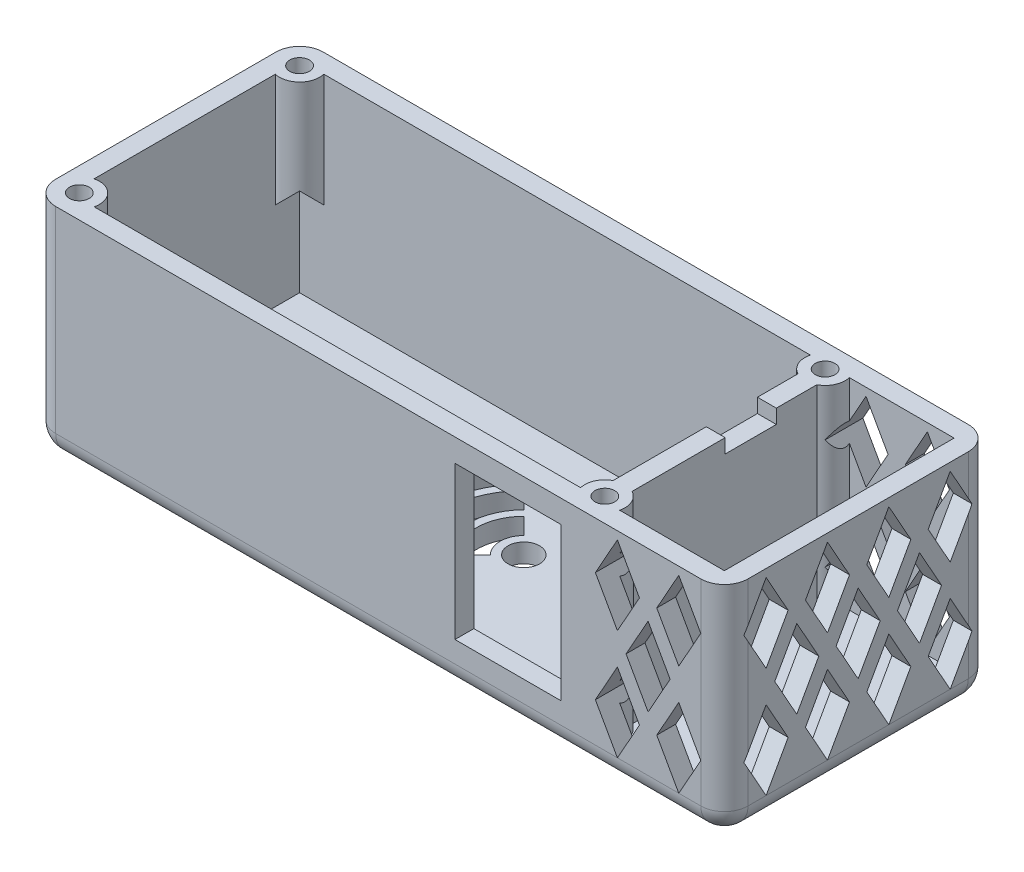
from build123d import *

# Parameters (mm, degrees)
SKETCH1_W           = 71
SKETCH1_H           = 34
BOSS_EXTRUDE1_DEPTH = 28
SHELL1_T            = -2.4
SKETCH2_W           = 2.4
SKETCH2_H           = 6.5
CUT_EXTRUDE1_DEPTH  = 1.8
SKETCH3_W           = 17
SKETCH3_H           = 34
BOSS_EXTRUDE2_DEPTH = 28
SKETCH4_W           = 14.6
SKETCH4_H           = 29.2
CUT_EXTRUDE2_DEPTH  = 25.6
CUT_EXTRUDE3_REACH  = 63.881
SKETCH5_R           = 2
CUT_EXTRUDE4_REACH  = 95.899
CUT_EXTRUDE5_REACH  = 69.371
SKETCH8_W           = 13.5
SKETCH8_H           = 19.4
FILLET1_R           = 3
FILLET2_R           = 3
SKETCH11_R          = 2.5546875
BOSS_EXTRUDE3_DEPTH = 25.6
SKETCH14_R          = 2.5546875
BOSS_EXTRUDE4_DEPTH = 12
CHAMFER1_SIZE       = 2.4
CUT_EXTRUDE6_DEPTH  = 69.529190861
SKETCH12_R          = 1.25
CUT_EXTRUDE7_DEPTH  = 12


# Some blends are built 0.0001 mm under size
with BuildPart() as part:
    # Sketch1 → Boss-Extrude1 (new body)
    with BuildSketch(Plane(origin=(0, 0, 0), x_dir=(1, 0, 0), z_dir=(0, 1, 0))):
        Rectangle(SKETCH1_W, SKETCH1_H)
    extrude(amount=BOSS_EXTRUDE1_DEPTH)

    # Shell1
    shell1_openings = [part.faces().sort_by_distance(p)[0] for p in [
        (0, 28, 0),
    ]]
    offset(amount=SHELL1_T, openings=shell1_openings, kind=Kind.INTERSECTION)

    # Sketch2 → Cut-Extrude1 (cut)
    with BuildSketch(Plane(origin=(0, 28, 0), x_dir=(1, 0, 0), z_dir=(0, 1, 0))):
        with Locations((34.3, 3.35)):
            Rectangle(SKETCH2_W, SKETCH2_H)
    extrude(amount=-CUT_EXTRUDE1_DEPTH, mode=Mode.SUBTRACT)

    # Sketch3 → Boss-Extrude2 (add)
    with BuildSketch(Plane.XZ):
        with Locations((44, 0)):
            Rectangle(SKETCH3_W, SKETCH3_H)
    extrude(amount=-BOSS_EXTRUDE2_DEPTH)

    # Sketch4 → Cut-Extrude2 (cut)
    with BuildSketch(Plane(origin=(0, 28, 0), x_dir=(1, 0, 0), z_dir=(0, 1, 0))):
        with Locations((42.8, 0)):
            Rectangle(SKETCH4_W, SKETCH4_H)
    extrude(amount=-CUT_EXTRUDE2_DEPTH, mode=Mode.SUBTRACT)

    # Sketch5 → Cut-Extrude3 (cut, up to next)
    with BuildSketch(Plane.XZ, mode=Mode.PRIVATE) as cut_extrude3_sk1:
        with Locations(Location((10, 0, 0), (0, 0, 270))):
            Circle(SKETCH5_R)
    cut_extrude3_tool1 = extrude(cut_extrude3_sk1.sketch, amount=-CUT_EXTRUDE3_REACH, mode=Mode.PRIVATE) & part.part
    # Sketch5 → Cut-Extrude3 (cut, up to next)
    with BuildSketch(Plane.XZ, mode=Mode.PRIVATE) as cut_extrude3_sk2:
        with BuildLine():
            Line((7.878679656, 2.121320344), (5.757359313, 4.242640687))
            ThreePointArc((5.757359313, 4.242640687), (4, 0), (5.757359313, -4.242640687))
            Line((5.757359313, -4.242640687), (7.878679656, -2.121320344))
            ThreePointArc((7.878679656, -2.121320344), (7, 0), (7.878679656, 2.121320344))
        make_face()
    cut_extrude3_tool2 = extrude(cut_extrude3_sk2.sketch, amount=-CUT_EXTRUDE3_REACH, mode=Mode.PRIVATE) & part.part
    # Sketch5 → Cut-Extrude3 (cut, up to next)
    with BuildSketch(Plane.XZ, mode=Mode.PRIVATE) as cut_extrude3_sk3:
        with BuildLine():
            Line((2.221825407, -7.778174593), (0.100505063, -9.899494937))
            ThreePointArc((0.100505063, -9.899494937), (-4, 0), (0.100505063, 9.899494937))
            Line((0.100505063, 9.899494937), (2.221825407, 7.778174593))
            ThreePointArc((2.221825407, 7.778174593), (-1, 0), (2.221825407, -7.778174593))
        make_face()
    cut_extrude3_tool3 = extrude(cut_extrude3_sk3.sketch, amount=-CUT_EXTRUDE3_REACH, mode=Mode.PRIVATE) & part.part
    # Sketch5 → Cut-Extrude3 (cut, up to next)
    with BuildSketch(Plane.XZ, mode=Mode.PRIVATE) as cut_extrude3_sk4:
        with BuildLine():
            Line((5.050252532, -4.949747468), (2.928932188, -7.071067812))
            ThreePointArc((2.928932188, -7.071067812), (0, 0), (2.928932188, 7.071067812))
            Line((2.928932188, 7.071067812), (5.050252532, 4.949747468))
            ThreePointArc((5.050252532, 4.949747468), (3, 0), (5.050252532, -4.949747468))
        make_face()
    cut_extrude3_tool4 = extrude(cut_extrude3_sk4.sketch, amount=-CUT_EXTRUDE3_REACH, mode=Mode.PRIVATE) & part.part
    add(cut_extrude3_tool1.solids().sort_by_distance((10, 0, 0))[0], mode=Mode.SUBTRACT)
    add(cut_extrude3_tool2.solids().sort_by_distance((5.798524, 0, 0))[0], mode=Mode.SUBTRACT)
    add(cut_extrude3_tool3.solids().sort_by_distance((-1.307973, 0, 0))[0], mode=Mode.SUBTRACT)
    add(cut_extrude3_tool4.solids().sort_by_distance((2.267872, 0, 0))[0], mode=Mode.SUBTRACT)

    # Sketch7 → Cut-Extrude4 (cut, up to next)
    with BuildSketch(Plane(origin=(52.5, 0, 0), x_dir=(0, 0, -1), z_dir=(1, 0, 0)), mode=Mode.PRIVATE) as cut_extrude4_sk1:
        Polygon((11.7, 13), (8.9, 8), (11.7, 3), (14.5, 8), align=None)
    cut_extrude4_tool1 = extrude(cut_extrude4_sk1.sketch, amount=-CUT_EXTRUDE4_REACH, mode=Mode.PRIVATE) & part.part
    # Sketch7 → Cut-Extrude4 (cut, up to next)
    with BuildSketch(Plane(origin=(52.5, 0, 0), x_dir=(0, 0, -1), z_dir=(1, 0, 0)), mode=Mode.PRIVATE) as cut_extrude4_sk2:
        Polygon((6.7, 8), (3.9, 3), (1.1, 8), (3.9, 13), align=None)
    cut_extrude4_tool2 = extrude(cut_extrude4_sk2.sketch, amount=-CUT_EXTRUDE4_REACH, mode=Mode.PRIVATE) & part.part
    # Sketch7 → Cut-Extrude4 (cut, up to next)
    with BuildSketch(Plane(origin=(52.5, 0, 0), x_dir=(0, 0, -1), z_dir=(1, 0, 0)), mode=Mode.PRIVATE) as cut_extrude4_sk3:
        Polygon((-1.1, 8), (-3.9, 3), (-6.7, 8), (-3.9, 13), align=None)
    cut_extrude4_tool3 = extrude(cut_extrude4_sk3.sketch, amount=-CUT_EXTRUDE4_REACH, mode=Mode.PRIVATE) & part.part
    # Sketch7 → Cut-Extrude4 (cut, up to next)
    with BuildSketch(Plane(origin=(52.5, 0, 0), x_dir=(0, 0, -1), z_dir=(1, 0, 0)), mode=Mode.PRIVATE) as cut_extrude4_sk4:
        Polygon((-8.9, 8), (-11.7, 3), (-14.5, 8), (-11.7, 13), align=None)
    cut_extrude4_tool4 = extrude(cut_extrude4_sk4.sketch, amount=-CUT_EXTRUDE4_REACH, mode=Mode.PRIVATE) & part.part
    # Sketch7 → Cut-Extrude4 (cut, up to next)
    with BuildSketch(Plane(origin=(52.5, 0, 0), x_dir=(0, 0, -1), z_dir=(1, 0, 0)), mode=Mode.PRIVATE) as cut_extrude4_sk5:
        Polygon((10.6, 15), (7.8, 10), (5, 15), (7.8, 20), align=None)
    cut_extrude4_tool5 = extrude(cut_extrude4_sk5.sketch, amount=-CUT_EXTRUDE4_REACH, mode=Mode.PRIVATE) & part.part
    # Sketch7 → Cut-Extrude4 (cut, up to next)
    with BuildSketch(Plane(origin=(52.5, 0, 0), x_dir=(0, 0, -1), z_dir=(1, 0, 0)), mode=Mode.PRIVATE) as cut_extrude4_sk6:
        Polygon((2.8, 15), (0, 10), (-2.8, 15), (0, 20), align=None)
    cut_extrude4_tool6 = extrude(cut_extrude4_sk6.sketch, amount=-CUT_EXTRUDE4_REACH, mode=Mode.PRIVATE) & part.part
    # Sketch7 → Cut-Extrude4 (cut, up to next)
    with BuildSketch(Plane(origin=(52.5, 0, 0), x_dir=(0, 0, -1), z_dir=(1, 0, 0)), mode=Mode.PRIVATE) as cut_extrude4_sk7:
        Polygon((-5, 15), (-7.8, 10), (-10.6, 15), (-7.8, 20), align=None)
    cut_extrude4_tool7 = extrude(cut_extrude4_sk7.sketch, amount=-CUT_EXTRUDE4_REACH, mode=Mode.PRIVATE) & part.part
    # Sketch7 → Cut-Extrude4 (cut, up to next)
    with BuildSketch(Plane(origin=(52.5, 0, 0), x_dir=(0, 0, -1), z_dir=(1, 0, 0)), mode=Mode.PRIVATE) as cut_extrude4_sk8:
        Polygon((6.7, 22), (3.9, 17), (1.1, 22), (3.9, 27), align=None)
    cut_extrude4_tool8 = extrude(cut_extrude4_sk8.sketch, amount=-CUT_EXTRUDE4_REACH, mode=Mode.PRIVATE) & part.part
    # Sketch7 → Cut-Extrude4 (cut, up to next)
    with BuildSketch(Plane(origin=(52.5, 0, 0), x_dir=(0, 0, -1), z_dir=(1, 0, 0)), mode=Mode.PRIVATE) as cut_extrude4_sk9:
        Polygon((-1.1, 22), (-3.9, 17), (-6.7, 22), (-3.9, 27), align=None)
    cut_extrude4_tool9 = extrude(cut_extrude4_sk9.sketch, amount=-CUT_EXTRUDE4_REACH, mode=Mode.PRIVATE) & part.part
    # Sketch7 → Cut-Extrude4 (cut, up to next)
    with BuildSketch(Plane(origin=(52.5, 0, 0), x_dir=(0, 0, -1), z_dir=(1, 0, 0)), mode=Mode.PRIVATE) as cut_extrude4_sk10:
        Polygon((-8.9, 22), (-11.7, 17), (-14.5, 22), (-11.7, 27), align=None)
    cut_extrude4_tool10 = extrude(cut_extrude4_sk10.sketch, amount=-CUT_EXTRUDE4_REACH, mode=Mode.PRIVATE) & part.part
    # Sketch7 → Cut-Extrude4 (cut, up to next)
    with BuildSketch(Plane(origin=(52.5, 0, 0), x_dir=(0, 0, -1), z_dir=(1, 0, 0)), mode=Mode.PRIVATE) as cut_extrude4_sk11:
        Polygon((14.5, 22), (11.7, 17), (8.9, 22), (11.7, 27), align=None)
    cut_extrude4_tool11 = extrude(cut_extrude4_sk11.sketch, amount=-CUT_EXTRUDE4_REACH, mode=Mode.PRIVATE) & part.part
    add(cut_extrude4_tool1.solids().sort_by_distance((52.5, 8, -11.7))[0], mode=Mode.SUBTRACT)
    add(cut_extrude4_tool2.solids().sort_by_distance((52.5, 8, -3.9))[0], mode=Mode.SUBTRACT)
    add(cut_extrude4_tool3.solids().sort_by_distance((52.5, 8, 3.9))[0], mode=Mode.SUBTRACT)
    add(cut_extrude4_tool4.solids().sort_by_distance((52.5, 8, 11.7))[0], mode=Mode.SUBTRACT)
    add(cut_extrude4_tool5.solids().sort_by_distance((52.5, 15, -7.8))[0], mode=Mode.SUBTRACT)
    add(cut_extrude4_tool6.solids().sort_by_distance((52.5, 15, 0))[0], mode=Mode.SUBTRACT)
    add(cut_extrude4_tool7.solids().sort_by_distance((52.5, 15, 7.8))[0], mode=Mode.SUBTRACT)
    add(cut_extrude4_tool8.solids().sort_by_distance((52.5, 22, -3.9))[0], mode=Mode.SUBTRACT)
    add(cut_extrude4_tool9.solids().sort_by_distance((52.5, 22, 3.9))[0], mode=Mode.SUBTRACT)
    add(cut_extrude4_tool10.solids().sort_by_distance((52.5, 22, 11.7))[0], mode=Mode.SUBTRACT)
    add(cut_extrude4_tool11.solids().sort_by_distance((52.5, 22, -11.7))[0], mode=Mode.SUBTRACT)

    # Sketch8 → Cut-Extrude5 (cut, up to next)
    with BuildSketch(Plane(origin=(0, 0, 14.6), x_dir=(-1, 0, 0), z_dir=(0, 0, -1)), mode=Mode.PRIVATE) as cut_extrude5_sk1:
        with Locations((-25, 15.4)):
            Rectangle(SKETCH8_W, SKETCH8_H)
    cut_extrude5_tool1 = extrude(cut_extrude5_sk1.sketch, amount=-CUT_EXTRUDE5_REACH, mode=Mode.PRIVATE) & part.part
    add(cut_extrude5_tool1.solids().sort_by_distance((25, 15.4, 14.6))[0], mode=Mode.SUBTRACT)

    # Fillet1
    # the kernel refuses this fillet: 3 mm, written as the material it takes off along each edge
    with BuildSketch(Plane(origin=(52.5, -7.5, -17), x_dir=(-1, 0, 0), z_dir=(0, 1, 0)), Plane(origin=(52.5, -7.5, 17), x_dir=(0, 0, -1), z_dir=(0, 1, 0))) as fillet1_piece_1:
        with BuildLine():
            CenterArc((FILLET1_R, FILLET1_R), FILLET1_R, 180, 90)
            Line((0, FILLET1_R), (0, 0))
            Line((0, 0), (FILLET1_R, 0))
        make_face()
    extrude(amount=43, mode=Mode.SUBTRACT)
    with BuildSketch(Plane(origin=(-35.5, -7.5, 17), x_dir=(0, 0, -1), z_dir=(0, 1, 0)), Plane(origin=(-35.5, -7.5, -17), x_dir=(1, 0, 0), z_dir=(0, 1, 0))) as fillet1_piece_2:
        with BuildLine():
            CenterArc((FILLET1_R, -FILLET1_R), FILLET1_R, 90, 90)
            Line((0, -FILLET1_R), (0, 0))
            Line((0, 0), (FILLET1_R, 0))
        make_face()
    extrude(amount=43, mode=Mode.SUBTRACT)

    # Fillet2
    fillet2_edges = [part.edges().sort_by_distance(p)[0] for p in [
        (8.5, 0, 17),
        (8.5, 0, -17),
        (52.5, 0, 0),
        (-35.5, 0, 0),
        (51.621320344, 0, 16.121320344),
        (51.621320344, 0, -16.121320344),
        (-34.621320344, 0, -16.121320344),
        (-34.621320344, 0, 16.121320344),
    ]]
    fillet(fillet2_edges, radius=FILLET2_R - 0.0001)  # a hair under: the kernel refuses the full size

    # Sketch11 → Boss-Extrude3 (add)
    with BuildSketch(Plane(origin=(0, 28, 0), x_dir=(1, 0, 0), z_dir=(0, 1, 0))):
        with Locations((34.3, -14)):
            Circle(SKETCH11_R)
        with Locations((34.3, 14)):
            Circle(SKETCH11_R)
    extrude(amount=-BOSS_EXTRUDE3_DEPTH)

    # Sketch14 → Boss-Extrude4 (add)
    with BuildSketch(Plane(origin=(0, 28, -28), x_dir=(1, 0, 0), z_dir=(0, -1, 0))):
        with Locations((-32.5, 42)):
            Circle(SKETCH14_R)
        with Locations((-32.5, 14)):
            Circle(SKETCH14_R)
    extrude(amount=BOSS_EXTRUDE4_DEPTH)

    # Chamfer1
    chamfer1_edges = [part.edges().sort_by_distance(p)[0] for p in [
        (-31.558385303, 16, 14.6),
        (-33.1, 16, 13.058385303),
        (-31.558385303, 16, -14.6),
        (-33.1, 16, -13.058385303),
    ]]
    chamfer(chamfer1_edges, length=CHAMFER1_SIZE)

    # Sketch10 → Cut-Extrude6 (cut, through all)
    with BuildSketch(Plane.XY.offset(17)):
        Polygon((46.7, 13), (43.9, 8), (46.7, 3), (49.5, 8), align=None)
        Polygon((41.7, 8), (38.9, 3), (36.1, 8), (38.9, 13), align=None)
        Polygon((45.6, 15), (42.8, 10), (40, 15), (42.8, 20), align=None)
        Polygon((41.7, 22), (38.9, 17), (36.1, 22), (38.9, 27), align=None)
        Polygon((49.5, 22), (46.7, 17), (43.9, 22), (46.7, 27), align=None)
    extrude(amount=-CUT_EXTRUDE6_DEPTH, mode=Mode.SUBTRACT)

    # Sketch12 → Cut-Extrude7 (cut)
    with BuildSketch(Plane(origin=(0, 28, 0), x_dir=(1, 0, 0), z_dir=(0, 1, 0))):
        with Locations(Location((34.3, 14, 0), (0, 0, 270))):
            Circle(SKETCH12_R)
        with Locations(Location((34.3, -14, 0), (0, 0, 270))):
            Circle(SKETCH12_R)
        with Locations(Location((-32.5, -14, 0), (0, 0, 270))):
            Circle(SKETCH12_R)
        with Locations(Location((-32.5, 14, 0), (0, 0, 270))):
            Circle(SKETCH12_R)
    extrude(amount=-CUT_EXTRUDE7_DEPTH, mode=Mode.SUBTRACT)


solid = part.part
